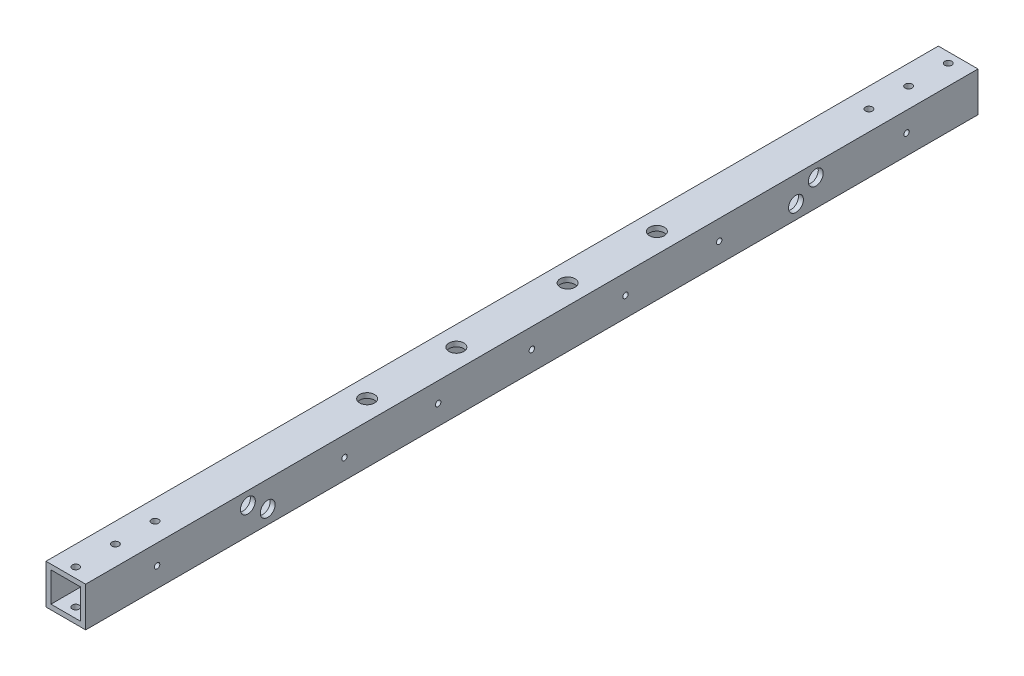
from build123d import *

# Parameters (mm, degrees)
SKETCH1_W                    = 25.4
SKETCH1_H                    = 25.4
SKETCH1_W_2                  = 19.05
SKETCH1_H_2                  = 19.05
EXTRUDE_THIN1_DEPTH          = 571.5
F_8_CLEARANCE_HOLE1_D        = 4.4958
F_8_32_TAPPED_HOLE1_D        = 3.4544
F_8_32_TAPPED_HOLE1_DEPTH    = 12.2936
F_8_32_TAPPED_HOLE1_TIP      = 1.037806461
F_3_8_0_375_DIAMETER_HOLE2_D = 9.525
F_3_8_0_375_DIAMETER_HOLE3_D = 9.525


with BuildPart() as part:
    # Sketch1 → Extrude-Thin1 (new body)
    with BuildSketch(Plane.XY):
        Rectangle(SKETCH1_W, SKETCH1_H)
        Rectangle(SKETCH1_W_2, SKETCH1_H_2, mode=Mode.SUBTRACT)
    extrude(amount=EXTRUDE_THIN1_DEPTH)

    # #8 Clearance Hole1 (through all)
    with Locations(Plane(origin=(0, 12.7, 565.15), x_dir=(0, 0, 1), z_dir=(0, 1, 0))):
        with Locations((0, 0), (-558.8, 0), (-533.4, 0), (-508, 0), (-25.4, 0), (-50.8, 0)):
            Hole(F_8_CLEARANCE_HOLE1_D / 2)

    # #8-32 Tapped Hole1
    with Locations(Plane(origin=(12.7, -53.975, 285.75), x_dir=(0, 0, -1), z_dir=(1, 0, 0))):
        with Locations((-240, 53.975), (-120, 53.975), (-60, 53.975), (0, 53.975), (60, 53.975), (120, 53.975), (240, 53.975)):
            Hole(F_8_32_TAPPED_HOLE1_D / 2, depth=F_8_32_TAPPED_HOLE1_DEPTH)
            with Locations((0, 0, -(F_8_32_TAPPED_HOLE1_DEPTH + F_8_32_TAPPED_HOLE1_TIP / 2))):  # 118° drill point
                Cone(0, F_8_32_TAPPED_HOLE1_D / 2, F_8_32_TAPPED_HOLE1_TIP, mode=Mode.SUBTRACT)

    # 3/8 (0.375) Diameter Hole2 (through all)
    with Locations(Plane(origin=(-12.7, -82.55, 285.75), x_dir=(0, 0, -1), z_dir=(-1, 0, 0))):
        with Locations((-181.864, -86.995), (-169.164, -78.74), (169.164, -78.74), (181.864, -86.995), (181.864, -57.15), (-181.864, -57.15)):
            Hole(F_3_8_0_375_DIAMETER_HOLE2_D / 2)

    # 3/8 (0.375) Diameter Hole3 (through all)
    with Locations(Plane(origin=(-346.075, 12.7, 285.75), x_dir=(0, 0, 1), z_dir=(0, 1, 0))):
        with Locations((-92.7735, 346.075), (-35.6235, 346.075), (35.6235, 346.075), (92.7735, 346.075), (-19.05, -346.775), (53.975, -346.775), (127, -346.775), (-381, -114.3), (-381, -130.175), (-381, -146.05), (-381, 114.3), (-381, 98.425), (-381, 82.55)):
            Hole(F_3_8_0_375_DIAMETER_HOLE3_D / 2)


solid = part.part
